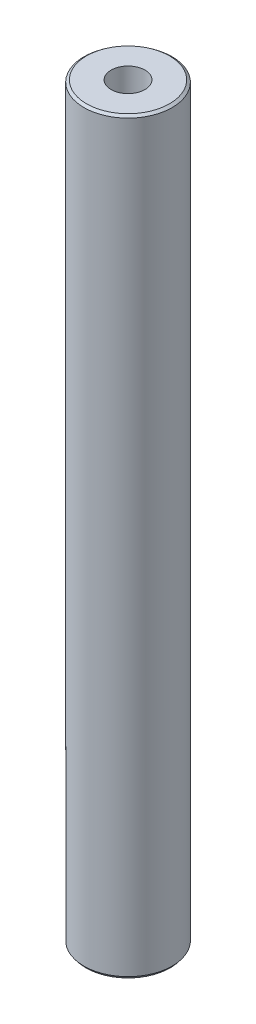
from build123d import *
from OCP.BRepFilletAPI import BRepFilletAPI_MakeChamfer

# Parameters (mm, degrees)
SKETCH1_R           = 10
BOSS_EXTRUDE1_DEPTH = 169.629749907
SKETCH2_R           = 3.841267599
CUT_EXTRUDE1_DEPTH  = 171.218248298
CHAMFER1_SIZE       = 0.453187587
CHAMFER1_SIZE2      = 0.588444119


with BuildPart() as part:
    # Sketch1 → Boss-Extrude1 (new body)
    with BuildSketch(Plane(origin=(0, 0, 0), x_dir=(1, 0, 0), z_dir=(0, 1, 0))):
        Circle(SKETCH1_R)
    extrude(amount=BOSS_EXTRUDE1_DEPTH)

    # Sketch2 → Cut-Extrude1 (cut, through all)
    with BuildSketch(Plane(origin=(0, 0, 0), x_dir=(1, 0, 0), z_dir=(0, 1, 0))):
        Circle(SKETCH2_R)
    extrude(amount=CUT_EXTRUDE1_DEPTH, mode=Mode.SUBTRACT)

    # Chamfer1: one chamfer whose edges measure the first distance from different faces: ONE call of the kernel's chamfer builder (chamfer() names one face for all edges)
    chamfer1_edges_1 = [part.edges().sort_by_distance(p)[0] for p in [
        (-10, 169.629749907, 0),
    ]]
    chamfer1_side_1 = [part.faces().sort_by_distance(p)[0] for p in [
        (-10, 84.814874953, 0),
    ]]
    chamfer1_edges_2 = [part.edges().sort_by_distance(p)[0] for p in [
        (-10, 0, 0),
    ]]
    chamfer1_side_2 = [part.faces().sort_by_distance(p)[0] for p in [
        (-9.717157288, 0, 0),
    ]]
    chamfer1 = BRepFilletAPI_MakeChamfer(part.part.solid().wrapped)
    for e in chamfer1_edges_1:
        chamfer1.Add(CHAMFER1_SIZE, CHAMFER1_SIZE2, e.wrapped, chamfer1_side_1[0].wrapped)  # the first distance lies on this face
    for e in chamfer1_edges_2:
        chamfer1.Add(CHAMFER1_SIZE, CHAMFER1_SIZE2, e.wrapped, chamfer1_side_2[0].wrapped)  # the first distance lies on this face
    add(Compound.cast(chamfer1.Shape()), mode=Mode.REPLACE)


solid = part.part
